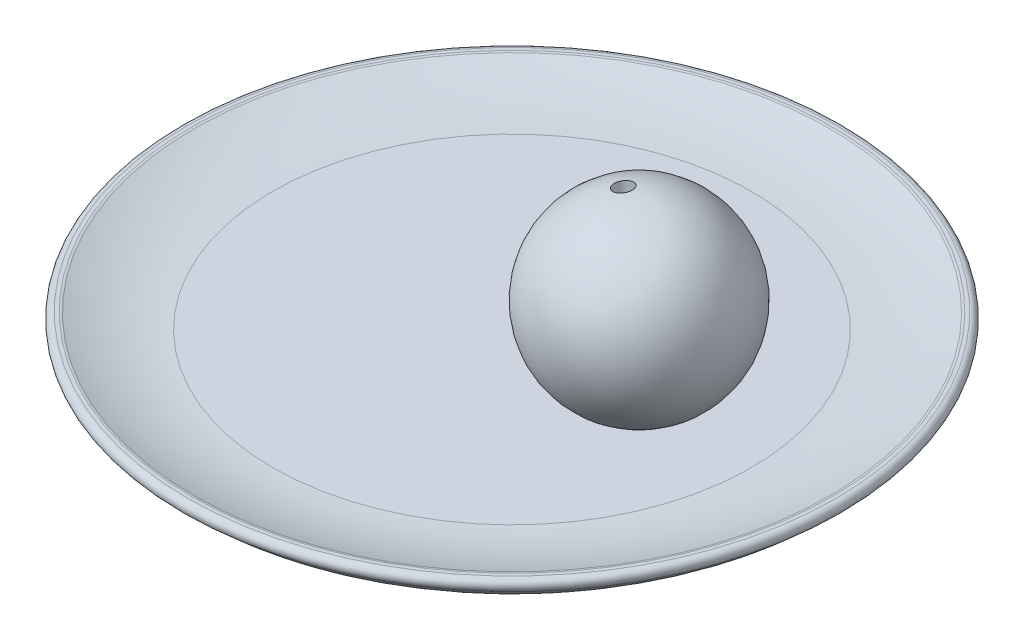
from build123d import *

# Parameters (mm, degrees)
SKETCH1_R           = 55
BOSS_EXTRUDE1_DEPTH = 7.5
SKETCH2_R           = 52
CUT_EXTRUDE1_DEPTH  = 2.5
FILLET1_R           = 35
FILLET3_R           = 20
FILLET4_R           = 1
SKETCH5_R           = 1.5
CUT_EXTRUDE2_DEPTH  = 15


with BuildPart() as part:
    # Sketch1 → Boss-Extrude1 (new body)
    with BuildSketch(Plane(origin=(0, 0, 0), x_dir=(1, 0, 0), z_dir=(0, 1, 0))):
        with Locations(Location((0, 0, 0), (0, 0, 270))):
            Circle(SKETCH1_R)
    extrude(amount=BOSS_EXTRUDE1_DEPTH)

    # Sketch2 → Cut-Extrude1 (cut)
    with BuildSketch(Plane(origin=(0, 7.5, 0), x_dir=(1, 0, 0), z_dir=(0, 1, 0))):
        with Locations(Location((0, 0, 0), (0, 0, 270))):
            Circle(SKETCH2_R)
    extrude(amount=-CUT_EXTRUDE1_DEPTH, mode=Mode.SUBTRACT)

    # Fillet1
    # the kernel refuses this fillet: 35 mm, written as the material it adds along each edge
    with BuildSketch(Plane(origin=(0, 5, 0), x_dir=(0, 0, 1), z_dir=(-1, 0, 0))) as fillet1_piece_1:
        with BuildLine():
            CenterArc((39.009618943, 35), FILLET1_R, 270, 21.786789298)
            Line((39.009618943, 0), (39.009618943, -0.7))
            Line((39.009618943, -0.7), (52, -0.7))
            Line((52, -0.7), (52.7, 0))
            ThreePointArc((52.7, 0), (52.7, 1.25), (52.259807621, 1.85))
            Line((52.259807621, 1.85), (52, 2.5))
        make_face()
    revolve(axis=Axis((0, 5, 0), (0, 1, 0)))

    # Fillet3
    # the kernel refuses this fillet: 20 mm, written as the material it takes off along each edge
    with BuildSketch(Plane(origin=(0, 0, 0), x_dir=(0, 0, 1), z_dir=(-1, 0, 0))) as fillet3_piece_1:
        with BuildLine():
            CenterArc((39.387505004, 20), FILLET3_R, 270, 51.317812547)
            Line((39.387505004, 0), (39.387505004, -0.4))
            Line((39.387505004, -0.4), (55, -0.4))
            Line((55, -0.4), (55.4, 0))
            ThreePointArc((55.4, 0), (55.4, 3.75), (55.3122499, 7.25))
            Line((55.3122499, 7.25), (55, 7.5))
        make_face()
    revolve(axis=Axis((0, 0, 0), (0, 1, 0)), mode=Mode.SUBTRACT)

    # Fillet4
    fillet4_edges = [part.edges().sort_by_distance(p)[0] for p in [
        (0, 7.5, -55),
        (0, 7.5, -52),
    ]]
    fillet(fillet4_edges, radius=FILLET4_R)

    # Sketch3 → Revolve1 (revolve)
    with BuildSketch(Plane.XY):
        with BuildLine():
            Line((20.726689781, 4.510750885), (20.726689781, 34.510750885))
            ThreePointArc((20.726689781, 34.510750885), (35.726689781, 19.510750885), (20.726689781, 4.510750885))
        make_face()
    revolve(axis=Axis((20.726689781, 4.510750885, 0), (0, 1, 0)))

    # Sketch5 → Cut-Extrude2 (cut)
    with BuildSketch(Plane(origin=(-5.316271402, 30.150073349, 0), x_dir=(0.9848077530122074, 0.17364817766693472, 0), z_dir=(-0.17364817766693474, 0.9848077530122075, 0))):
        with Locations(Location((23.799811127, 0, 0), (0, 0, 180))):
            Circle(SKETCH5_R)
    extrude(amount=-CUT_EXTRUDE2_DEPTH, mode=Mode.SUBTRACT)


solid = part.part
